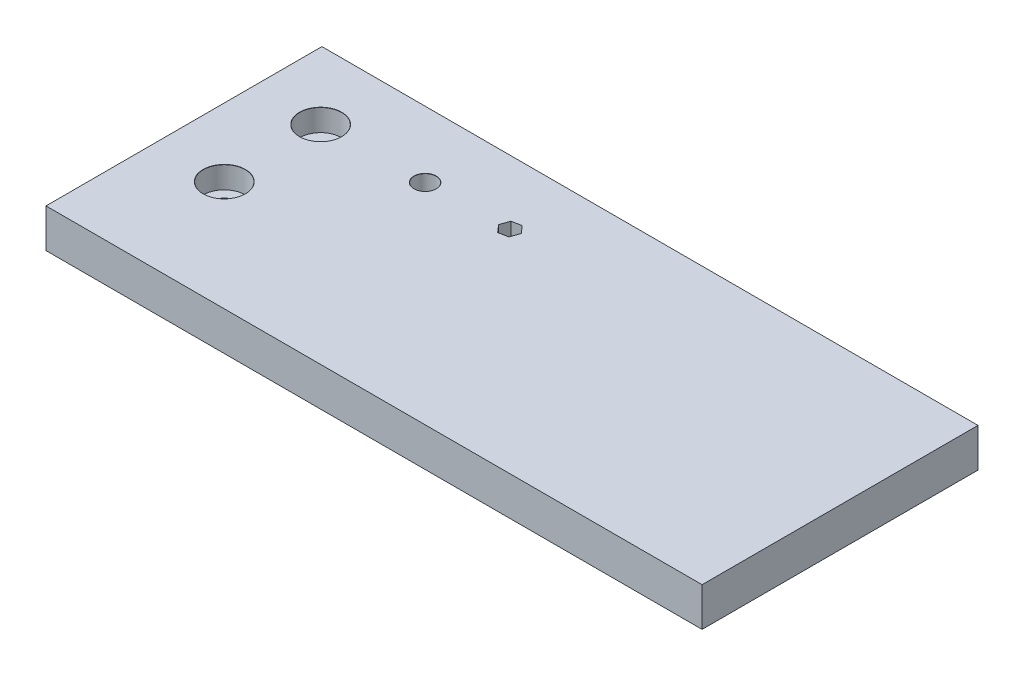
from build123d import *

# Parameters (mm, degrees)
SKETCH1_W                      = 101.6
SKETCH1_H                      = 42.727601577
BOSS_EXTRUDE2_DEPTH            = 6
M3_CLEARANCE_HOLE1_D           = 3.4
M3_CLEARANCE_HOLE1_CSINK_D     = 3.45
M3_CLEARANCE_HOLE1_CSINK_ANGLE = 90
CUT_EXTRUDE1_DEPTH             = 77.129253004


with BuildPart() as part:
    # Sketch1 → Boss-Extrude2 (new body)
    with BuildSketch(Plane(origin=(0, 0, 0), x_dir=(1, 0, 0), z_dir=(0, 1, 0))):
        with Locations((-9.585511853, -24.606332138)):
            Rectangle(SKETCH1_W, SKETCH1_H)
    extrude(amount=BOSS_EXTRUDE2_DEPTH)

    # Sketch5 → CBORE for M3 Hex Socket Head Cap Screw1 (revolve, cut)
    with BuildSketch(Plane(origin=(-50.044280369, 6, 13.782297963), x_dir=(0, 0, 1), z_dir=(1, 0, 0))):
        Polygon((0, 0), (0, 6), (1.6, 6), (1.6, 3.4), (3.25, 3.4), (3.25, 0.025), (3.275, 0), align=None)
    revolve(axis=Axis((-50.044280369, 12.35, 13.782297963), (0, -1, 0)), mode=Mode.SUBTRACT)

    # Sketch8 → CBORE for M3 Hex Socket Head Cap Screw2 (revolve, cut)
    with BuildSketch(Plane(origin=(-49.834104948, 6, 28.914928265), x_dir=(0, 0, 1), z_dir=(1, 0, 0))):
        Polygon((0, 0), (0, 6), (1.7, 6), (1.7, 3.4), (3.25, 3.4), (3.25, 0.025), (3.275, 0), align=None)
    revolve(axis=Axis((-49.834104948, 12.35, 28.914928265), (0, -1, 0)), mode=Mode.SUBTRACT)

    # M3 Clearance Hole1 (through all)
    with Locations(Plane(origin=(0, 6, 0), x_dir=(1, 0, 0), z_dir=(0, 1, 0))):
        with Locations((-34.176036094, -13.467034832)):
            CounterSinkHole(M3_CLEARANCE_HOLE1_D / 2, M3_CLEARANCE_HOLE1_CSINK_D / 2, counter_sink_angle=M3_CLEARANCE_HOLE1_CSINK_ANGLE)

    # Sketch17 → Cut-Extrude1 (cut, through all)
    with BuildSketch(Plane(origin=(0, 6, 0), x_dir=(1, 0, 0), z_dir=(0, 1, 0))):
        Polygon((-21.847349351, -14.573742746), (-20.374174215, -14.291333434), (-19.882160285, -12.874321687), (-20.863321491, -11.739719251), (-22.336496627, -12.022128562), (-22.828510557, -13.43914031), align=None)
    extrude(amount=-CUT_EXTRUDE1_DEPTH, mode=Mode.SUBTRACT)


solid = part.part
